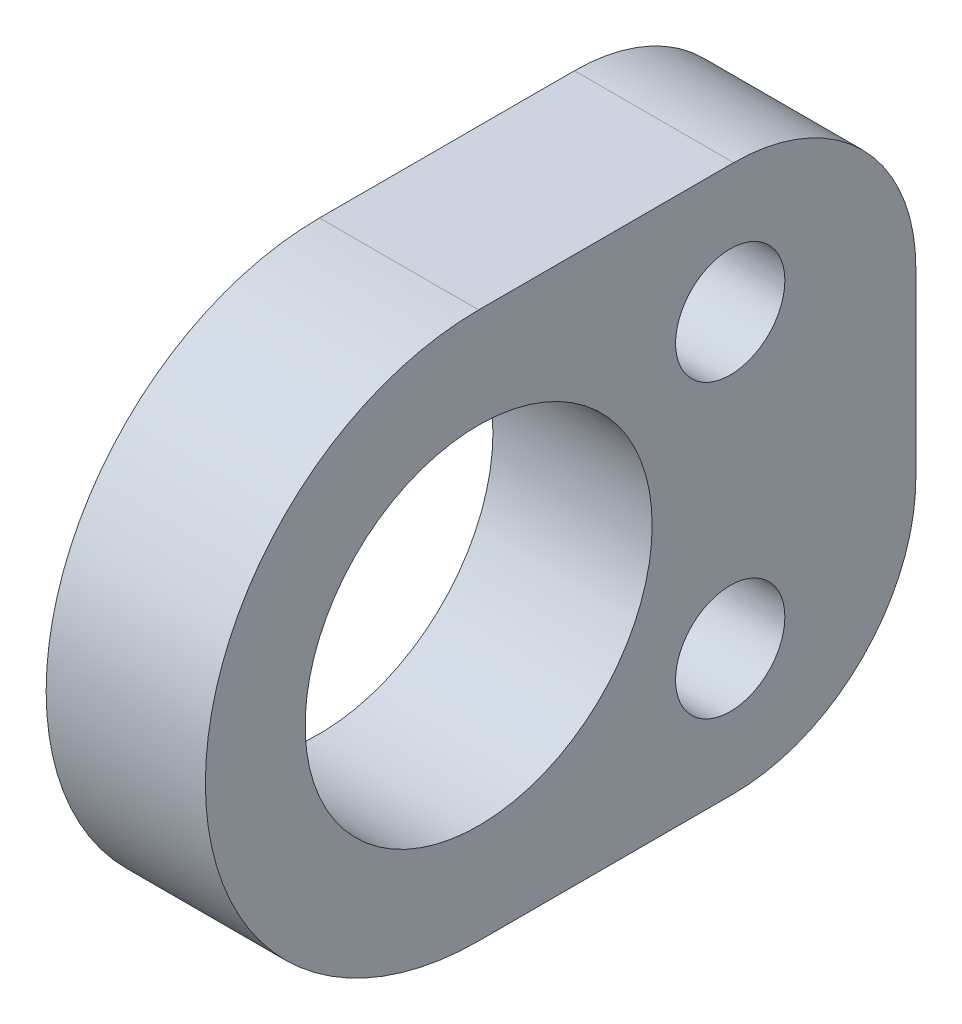
from build123d import *

# Parameters (mm, degrees)
SKETCH1_R           = 1.5
SKETCH1_R_2         = 4.7625
BOSS_EXTRUDE1_DEPTH = 4.37
FILLET1_R           = 5


with BuildPart() as part:
    # Sketch1 → Boss-Extrude1 (new body)
    with BuildSketch(Plane(origin=(0, 0, 0), x_dir=(0, 0, -1), z_dir=(1, 0, 0))):
        with BuildLine():
            Line((12, 7.5), (0, 7.5))
            ThreePointArc((0, 7.5), (-7.5, 0), (0, -7.5))
            Line((0, -7.5), (12, -7.5))
            Line((12, -7.5), (12, 7.5))
        make_face()
        with Locations((6.905099565, -4)):
            Circle(SKETCH1_R, mode=Mode.SUBTRACT)
        Circle(SKETCH1_R_2, mode=Mode.SUBTRACT)
        with Locations((6.905099565, 4)):
            Circle(SKETCH1_R, mode=Mode.SUBTRACT)
    extrude(amount=BOSS_EXTRUDE1_DEPTH)

    # Fillet1
    fillet1_edges = [part.edges().sort_by_distance(p)[0] for p in [
        (2.185, 7.5, -12),
        (2.185, -7.5, -12),
    ]]
    fillet(fillet1_edges, radius=FILLET1_R)


solid = part.part
